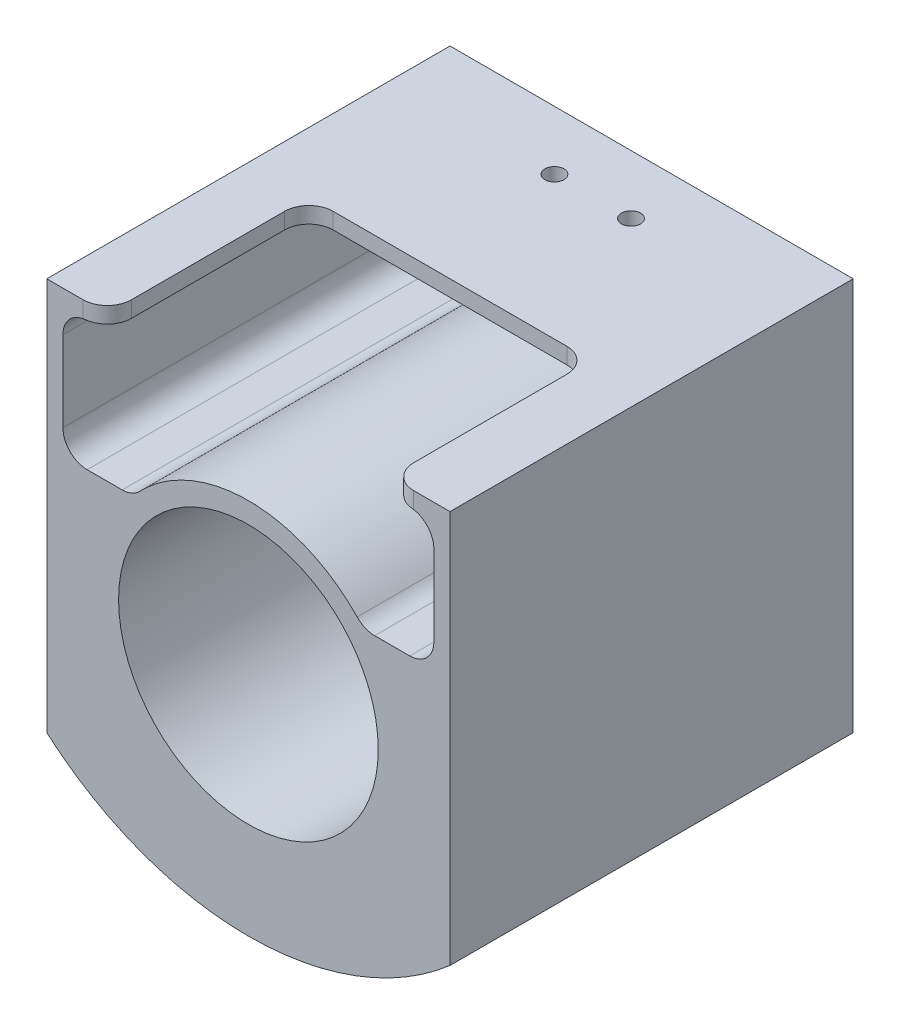
from build123d import *

# Parameters (mm, degrees)
BOSS_EXTRUDE2_DEPTH     = 50
CUT_EXTRUDE1_DEPTH      = 68.650646708
CUT_EXTRUDE1_DEPTH_BACK = 68.650646708
SKETCH2_R               = 16.1
CUT_EXTRUDE3_DEPTH      = 68.650646708
FILLET1_R               = 3
SKETCH5_W               = 35
SKETCH5_H               = 25
CUT_EXTRUDE4_DEPTH      = 10
FILLET2_R               = 3
SKETCH6_R               = 16.1
SKETCH6_R_2             = 9.5
SKETCH6_R_3             = 1.25
BOSS_EXTRUDE3_DEPTH     = 5
CUT_EXTRUDE5_DEPTH      = 68.650646782
CUT_EXTRUDE5_DEPTH_BACK = 68.650646782
SKETCH7_R               = 2.25
CUT_EXTRUDE6_REACH      = 82.626
SKETCH8_R               = 1.175


with BuildPart() as part:
    # Sketch1 → Boss-Extrude2 (new body)
    with BuildSketch(Plane.XY):
        with BuildLine():
            Line((-25, 0), (-25, -28.750826075))
            ThreePointArc((-25, -28.750826075), (0, -38.1), (25, -28.750826075))
            Line((25, -28.750826075), (25, 0))
            Line((25, 0), (25, 20))
            Line((25, 20), (-25, 20))
            Line((-25, 20), (-25, 0))
        make_face()
    extrude(amount=BOSS_EXTRUDE2_DEPTH)

    # Sketch2 → Cut-Extrude1 (cut, two sides: drawn at the far end of the back side and taken through both)
    with BuildSketch(Plane.XY.offset(50).offset(-CUT_EXTRUDE1_DEPTH_BACK)):
        with Locations((0, -10)):
            Circle(SKETCH2_R)
    extrude(amount=CUT_EXTRUDE1_DEPTH + CUT_EXTRUDE1_DEPTH_BACK, mode=Mode.SUBTRACT)

    # Sketch4 → Cut-Extrude3 (cut, through all)
    with BuildSketch(Plane.XY.offset(50)):
        with BuildLine():
            Line((-23, 18), (23, 18))
            Line((23, 18), (23, 2))
            Line((23, 2), (14.317821063, 2))
            ThreePointArc((14.317821063, 2), (0, 8.681541692), (-14.317821063, 2))
            Line((-14.317821063, 2), (-23, 2))
            Line((-23, 2), (-23, 18))
        make_face()
    extrude(amount=-CUT_EXTRUDE3_DEPTH, mode=Mode.SUBTRACT)

    # Fillet1
    fillet1_edges = [part.edges().sort_by_distance(p)[0] for p in [
        (23, 18, 25),
        (23, 2, 25),
        (14.317821063, 2, 25),
        (-14.317821063, 2, 25),
        (-23, 2, 25),
        (-23, 18, 25),
    ]]
    fillet(fillet1_edges, radius=FILLET1_R)

    # Sketch5 → Cut-Extrude4 (cut)
    with BuildSketch(Plane(origin=(0, 20, 0), x_dir=(1, 0, 0), z_dir=(0, 1, 0))):
        with Locations((0, -37.5)):
            Rectangle(SKETCH5_W, SKETCH5_H)
    extrude(amount=-CUT_EXTRUDE4_DEPTH, mode=Mode.SUBTRACT)

    # Fillet2
    fillet2_edges = [part.edges().sort_by_distance(p)[0] for p in [
        (17.5, 19, 50),
        (17.5, 19, 25),
        (-17.5, 19, 25),
        (-17.5, 19, 50),
    ]]
    fillet(fillet2_edges, radius=FILLET2_R)

    # Sketch6 → Boss-Extrude3 (add)
    with BuildSketch(Plane.XY.offset(14)):
        with Locations((0, -10)):
            Circle(SKETCH6_R)
        with Locations((0, -10)):
            Circle(SKETCH6_R_2, mode=Mode.SUBTRACT)
        with Locations((0, 3)):
            Circle(SKETCH6_R_3, mode=Mode.SUBTRACT)
        with Locations((13, -10)):
            Circle(SKETCH6_R_3, mode=Mode.SUBTRACT)
        with Locations((-13, -10)):
            Circle(SKETCH6_R_3, mode=Mode.SUBTRACT)
        with Locations((0, -23)):
            Circle(SKETCH6_R_3, mode=Mode.SUBTRACT)
    extrude(amount=-BOSS_EXTRUDE3_DEPTH)

    # Sketch7 → Cut-Extrude5 (cut, two sides: drawn at the far end of the back side and taken through both)
    with BuildSketch(Plane(origin=(0, 0, 0), x_dir=(0, 0, -1), z_dir=(1, 0, 0)).offset(-CUT_EXTRUDE5_DEPTH_BACK)):
        with Locations((-40, -32)):
            Circle(SKETCH7_R)
        with Locations((-10, -32)):
            Circle(SKETCH7_R)
    extrude(amount=CUT_EXTRUDE5_DEPTH + CUT_EXTRUDE5_DEPTH_BACK, mode=Mode.SUBTRACT)

    # Sketch8 → Cut-Extrude6 (cut, up to next)
    with BuildSketch(Plane(origin=(0, 20, 0), x_dir=(1, 0, 0), z_dir=(0, 1, 0)), mode=Mode.PRIVATE) as cut_extrude6_sk1:
        with Locations((-4.75, -7.3)):
            Circle(SKETCH8_R)
    cut_extrude6_tool1 = extrude(cut_extrude6_sk1.sketch, amount=-CUT_EXTRUDE6_REACH, mode=Mode.PRIVATE) & part.part
    # Sketch8 → Cut-Extrude6 (cut, up to next)
    with BuildSketch(Plane(origin=(0, 20, 0), x_dir=(1, 0, 0), z_dir=(0, 1, 0)), mode=Mode.PRIVATE) as cut_extrude6_sk2:
        with Locations((4.75, -7.3)):
            Circle(SKETCH8_R)
    cut_extrude6_tool2 = extrude(cut_extrude6_sk2.sketch, amount=-CUT_EXTRUDE6_REACH, mode=Mode.PRIVATE) & part.part
    add(cut_extrude6_tool1.solids().sort_by_distance((-4.75, 20, 7.3))[0], mode=Mode.SUBTRACT)
    add(cut_extrude6_tool2.solids().sort_by_distance((4.75, 20, 7.3))[0], mode=Mode.SUBTRACT)


solid = part.part
